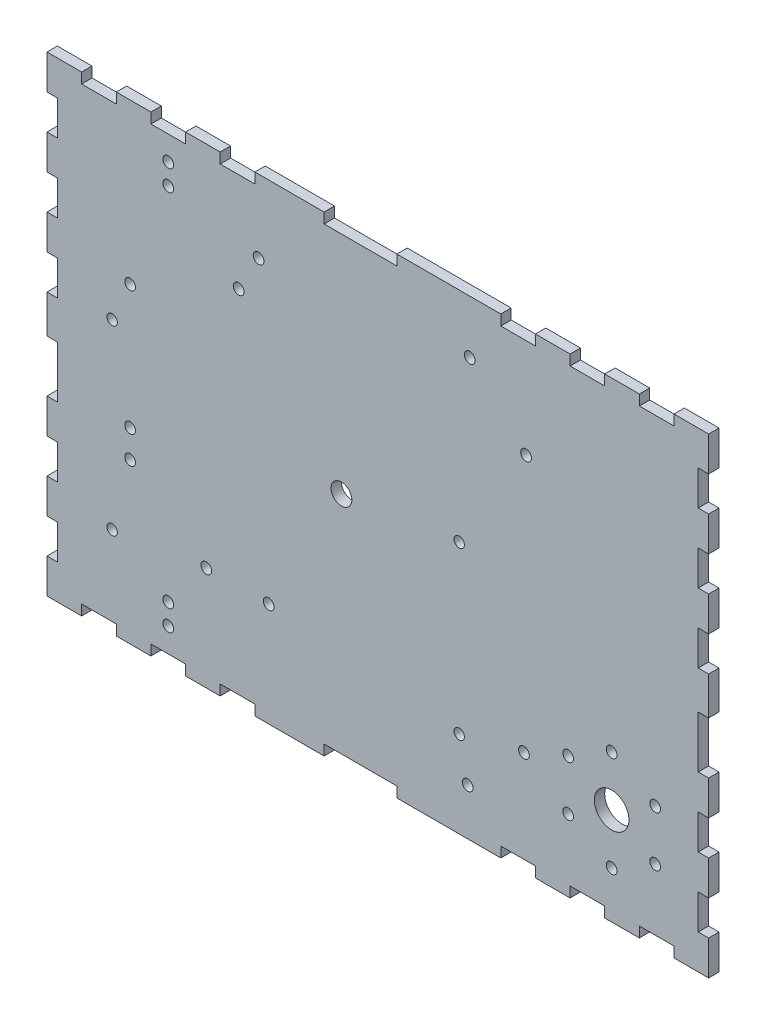
from build123d import *

# Parameters (mm, degrees)
SKETCH2_W           = 191
SKETCH2_H           = 136
SKETCH2_R           = 1.55
SKETCH2_R_2         = 1.549999948
SKETCH2_R_3         = 1.5
BOSS_EXTRUDE1_DEPTH = 3
CUT_EXTRUDE1_REACH  = 236.491
SKETCH3_W           = 10
SKETCH3_H           = 3
SKETCH3_W_2         = 21
CUT_EXTRUDE2_REACH  = 236.491
SKETCH4_W           = 3
SKETCH4_H           = 10
SKETCH4_H_2         = 15
CUT_EXTRUDE3_REACH  = 236.491
SKETCH8_R           = 5
CUT_EXTRUDE4_REACH  = 236.491
SKETCH9_R           = 3
CUT_EXTRUDE5_REACH  = 236.491
SKETCH10_R          = 1.55


with BuildPart() as part:
    # Sketch2 → Boss-Extrude1 (new body)
    with BuildSketch(Plane.XY):
        with Locations((95.5, 68)):
            Rectangle(SKETCH2_W, SKETCH2_H)
        with Locations((35, 16)):
            Circle(SKETCH2_R, mode=Mode.SUBTRACT)
        with Locations((35, 10)):
            Circle(SKETCH2_R, mode=Mode.SUBTRACT)
        with Locations((24, 46.069195574)):
            Circle(SKETCH2_R, mode=Mode.SUBTRACT)
        with Locations((24, 54.069195574)):
            Circle(SKETCH2_R, mode=Mode.SUBTRACT)
        with Locations((24, 89.930804426)):
            Circle(SKETCH2_R, mode=Mode.SUBTRACT)
        with Locations((35, 120)):
            Circle(SKETCH2_R, mode=Mode.SUBTRACT)
        with Locations((35, 126)):
            Circle(SKETCH2_R, mode=Mode.SUBTRACT)
        with Locations((175.557368355, 35.25)):
            Circle(SKETCH2_R_2, mode=Mode.SUBTRACT)
        with Locations((163, 42.5)):
            Circle(SKETCH2_R_2, mode=Mode.SUBTRACT)
        with Locations((150.442631645, 35.25)):
            Circle(SKETCH2_R_2, mode=Mode.SUBTRACT)
        with Locations((150.442631645, 20.75)):
            Circle(SKETCH2_R_2, mode=Mode.SUBTRACT)
        with Locations((163, 13.5)):
            Circle(SKETCH2_R_2, mode=Mode.SUBTRACT)
        with Locations((175.557368355, 20.75)):
            Circle(SKETCH2_R_2, mode=Mode.SUBTRACT)
        with Locations((18.8, 78.5)):
            Circle(SKETCH2_R_3, mode=Mode.SUBTRACT)
        with Locations((18.8, 26)):
            Circle(SKETCH2_R_3, mode=Mode.SUBTRACT)
        with Locations((119, 73)):
            Circle(SKETCH2_R_3, mode=Mode.SUBTRACT)
        with Locations((119, 25)):
            Circle(SKETCH2_R_3, mode=Mode.SUBTRACT)
    extrude(amount=BOSS_EXTRUDE1_DEPTH)

    # Sketch3 → Cut-Extrude1 (cut, up to next)
    with BuildSketch(Plane.XY.offset(3), mode=Mode.PRIVATE) as cut_extrude1_sk1:
        with Locations((176, 1.5)):
            Rectangle(SKETCH3_W, SKETCH3_H)
    cut_extrude1_tool1 = extrude(cut_extrude1_sk1.sketch, amount=-CUT_EXTRUDE1_REACH, mode=Mode.PRIVATE) & part.part
    # Sketch3 → Cut-Extrude1 (cut, up to next)
    with BuildSketch(Plane.XY.offset(3), mode=Mode.PRIVATE) as cut_extrude1_sk2:
        with Locations((156, 1.5)):
            Rectangle(SKETCH3_W, SKETCH3_H)
    cut_extrude1_tool2 = extrude(cut_extrude1_sk2.sketch, amount=-CUT_EXTRUDE1_REACH, mode=Mode.PRIVATE) & part.part
    # Sketch3 → Cut-Extrude1 (cut, up to next)
    with BuildSketch(Plane.XY.offset(3), mode=Mode.PRIVATE) as cut_extrude1_sk3:
        with Locations((136, 1.5)):
            Rectangle(SKETCH3_W, SKETCH3_H)
    cut_extrude1_tool3 = extrude(cut_extrude1_sk3.sketch, amount=-CUT_EXTRUDE1_REACH, mode=Mode.PRIVATE) & part.part
    # Sketch3 → Cut-Extrude1 (cut, up to next)
    with BuildSketch(Plane.XY.offset(3), mode=Mode.PRIVATE) as cut_extrude1_sk4:
        with Locations((90.5, 1.5)):
            Rectangle(SKETCH3_W_2, SKETCH3_H)
    cut_extrude1_tool4 = extrude(cut_extrude1_sk4.sketch, amount=-CUT_EXTRUDE1_REACH, mode=Mode.PRIVATE) & part.part
    # Sketch3 → Cut-Extrude1 (cut, up to next)
    with BuildSketch(Plane.XY.offset(3), mode=Mode.PRIVATE) as cut_extrude1_sk5:
        with Locations((55, 1.5)):
            Rectangle(SKETCH3_W, SKETCH3_H)
    cut_extrude1_tool5 = extrude(cut_extrude1_sk5.sketch, amount=-CUT_EXTRUDE1_REACH, mode=Mode.PRIVATE) & part.part
    # Sketch3 → Cut-Extrude1 (cut, up to next)
    with BuildSketch(Plane.XY.offset(3), mode=Mode.PRIVATE) as cut_extrude1_sk6:
        with Locations((35, 1.5)):
            Rectangle(SKETCH3_W, SKETCH3_H)
    cut_extrude1_tool6 = extrude(cut_extrude1_sk6.sketch, amount=-CUT_EXTRUDE1_REACH, mode=Mode.PRIVATE) & part.part
    # Sketch3 → Cut-Extrude1 (cut, up to next)
    with BuildSketch(Plane.XY.offset(3), mode=Mode.PRIVATE) as cut_extrude1_sk7:
        with Locations((15, 1.5)):
            Rectangle(SKETCH3_W, SKETCH3_H)
    cut_extrude1_tool7 = extrude(cut_extrude1_sk7.sketch, amount=-CUT_EXTRUDE1_REACH, mode=Mode.PRIVATE) & part.part
    cut_extrude1_1 = cut_extrude1_tool1.solids().sort_by_distance((176, 1.5, 3))[0]
    add(cut_extrude1_1, mode=Mode.SUBTRACT)
    cut_extrude1_2 = cut_extrude1_tool2.solids().sort_by_distance((156, 1.5, 3))[0]
    add(cut_extrude1_2, mode=Mode.SUBTRACT)
    cut_extrude1_3 = cut_extrude1_tool3.solids().sort_by_distance((136, 1.5, 3))[0]
    add(cut_extrude1_3, mode=Mode.SUBTRACT)
    cut_extrude1_4 = cut_extrude1_tool4.solids().sort_by_distance((90.5, 1.5, 3))[0]
    add(cut_extrude1_4, mode=Mode.SUBTRACT)
    cut_extrude1_5 = cut_extrude1_tool5.solids().sort_by_distance((55, 1.5, 3))[0]
    add(cut_extrude1_5, mode=Mode.SUBTRACT)
    cut_extrude1_6 = cut_extrude1_tool6.solids().sort_by_distance((35, 1.5, 3))[0]
    add(cut_extrude1_6, mode=Mode.SUBTRACT)
    cut_extrude1_7 = cut_extrude1_tool7.solids().sort_by_distance((15, 1.5, 3))[0]
    add(cut_extrude1_7, mode=Mode.SUBTRACT)
    cut_extrude1 = cut_extrude1_1 + cut_extrude1_2 + cut_extrude1_3 + cut_extrude1_4 + cut_extrude1_5 + cut_extrude1_6 + cut_extrude1_7  # Cut-Extrude1 as one shape, for the pattern or mirror that repeats it

    # Mirror1: Cut-Extrude1 across plane
    add(cut_extrude1.mirror(Plane.ZX.offset(68)), mode=Mode.SUBTRACT)

    # Sketch4 → Cut-Extrude2 (cut, up to next)
    with BuildSketch(Plane.XY.offset(3), mode=Mode.PRIVATE) as cut_extrude2_sk1:
        with Locations((1.5, 121)):
            Rectangle(SKETCH4_W, SKETCH4_H)
    cut_extrude2_tool1 = extrude(cut_extrude2_sk1.sketch, amount=-CUT_EXTRUDE2_REACH, mode=Mode.PRIVATE) & part.part
    # Sketch4 → Cut-Extrude2 (cut, up to next)
    with BuildSketch(Plane.XY.offset(3), mode=Mode.PRIVATE) as cut_extrude2_sk2:
        with Locations((1.5, 101)):
            Rectangle(SKETCH4_W, SKETCH4_H)
    cut_extrude2_tool2 = extrude(cut_extrude2_sk2.sketch, amount=-CUT_EXTRUDE2_REACH, mode=Mode.PRIVATE) & part.part
    # Sketch4 → Cut-Extrude2 (cut, up to next)
    with BuildSketch(Plane.XY.offset(3), mode=Mode.PRIVATE) as cut_extrude2_sk3:
        with Locations((1.5, 81)):
            Rectangle(SKETCH4_W, SKETCH4_H)
    cut_extrude2_tool3 = extrude(cut_extrude2_sk3.sketch, amount=-CUT_EXTRUDE2_REACH, mode=Mode.PRIVATE) & part.part
    # Sketch4 → Cut-Extrude2 (cut, up to next)
    with BuildSketch(Plane.XY.offset(3), mode=Mode.PRIVATE) as cut_extrude2_sk4:
        with Locations((1.5, 15)):
            Rectangle(SKETCH4_W, SKETCH4_H)
    cut_extrude2_tool4 = extrude(cut_extrude2_sk4.sketch, amount=-CUT_EXTRUDE2_REACH, mode=Mode.PRIVATE) & part.part
    # Sketch4 → Cut-Extrude2 (cut, up to next)
    with BuildSketch(Plane.XY.offset(3), mode=Mode.PRIVATE) as cut_extrude2_sk5:
        with Locations((1.5, 35)):
            Rectangle(SKETCH4_W, SKETCH4_H)
    cut_extrude2_tool5 = extrude(cut_extrude2_sk5.sketch, amount=-CUT_EXTRUDE2_REACH, mode=Mode.PRIVATE) & part.part
    # Sketch4 → Cut-Extrude2 (cut, up to next)
    with BuildSketch(Plane.XY.offset(3), mode=Mode.PRIVATE) as cut_extrude2_sk6:
        with Locations((1.5, 57.5)):
            Rectangle(SKETCH4_W, SKETCH4_H_2)
    cut_extrude2_tool6 = extrude(cut_extrude2_sk6.sketch, amount=-CUT_EXTRUDE2_REACH, mode=Mode.PRIVATE) & part.part
    cut_extrude2_1 = cut_extrude2_tool1.solids().sort_by_distance((1.5, 121, 3))[0]
    add(cut_extrude2_1, mode=Mode.SUBTRACT)
    cut_extrude2_2 = cut_extrude2_tool2.solids().sort_by_distance((1.5, 101, 3))[0]
    add(cut_extrude2_2, mode=Mode.SUBTRACT)
    cut_extrude2_3 = cut_extrude2_tool3.solids().sort_by_distance((1.5, 81, 3))[0]
    add(cut_extrude2_3, mode=Mode.SUBTRACT)
    cut_extrude2_4 = cut_extrude2_tool4.solids().sort_by_distance((1.5, 15, 3))[0]
    add(cut_extrude2_4, mode=Mode.SUBTRACT)
    cut_extrude2_5 = cut_extrude2_tool5.solids().sort_by_distance((1.5, 35, 3))[0]
    add(cut_extrude2_5, mode=Mode.SUBTRACT)
    cut_extrude2_6 = cut_extrude2_tool6.solids().sort_by_distance((1.5, 57.5, 3))[0]
    add(cut_extrude2_6, mode=Mode.SUBTRACT)
    cut_extrude2 = cut_extrude2_1 + cut_extrude2_2 + cut_extrude2_3 + cut_extrude2_4 + cut_extrude2_5 + cut_extrude2_6  # Cut-Extrude2 as one shape, for the pattern or mirror that repeats it

    # Mirror2: Cut-Extrude2 across plane
    add(cut_extrude2.mirror(Plane(origin=(95.5, 0, 0), x_dir=(0, 0, 1), z_dir=(1, 0, 0))), mode=Mode.SUBTRACT)

    # Sketch8 → Cut-Extrude3 (cut, up to next)
    with BuildSketch(Plane(origin=(0, 0, 0), x_dir=(-1, 0, 0), z_dir=(0, 0, -1)), mode=Mode.PRIVATE) as cut_extrude3_sk1:
        with Locations((-163, 28)):
            Circle(SKETCH8_R)
    cut_extrude3_tool1 = extrude(cut_extrude3_sk1.sketch, amount=-CUT_EXTRUDE3_REACH, mode=Mode.PRIVATE) & part.part
    add(cut_extrude3_tool1.solids().sort_by_distance((163, 28, 0))[0], mode=Mode.SUBTRACT)

    # Sketch9 → Cut-Extrude4 (cut, up to next)
    with BuildSketch(Plane.XY.offset(3), mode=Mode.PRIVATE) as cut_extrude4_sk1:
        with Locations((85, 68)):
            Circle(SKETCH9_R)
    cut_extrude4_tool1 = extrude(cut_extrude4_sk1.sketch, amount=-CUT_EXTRUDE4_REACH, mode=Mode.PRIVATE) & part.part
    add(cut_extrude4_tool1.solids().sort_by_distance((85, 68, 3))[0], mode=Mode.SUBTRACT)

    # Sketch10 → Cut-Extrude5 (cut, up to next)
    with BuildSketch(Plane.XY.offset(3), mode=Mode.PRIVATE) as cut_extrude5_sk1:
        with Locations((61.086070947, 114.989325612)):
            Circle(SKETCH10_R)
    cut_extrude5_tool1 = extrude(cut_extrude5_sk1.sketch, amount=-CUT_EXTRUDE5_REACH, mode=Mode.PRIVATE) & part.part
    # Sketch10 → Cut-Extrude5 (cut, up to next)
    with BuildSketch(Plane.XY.offset(3), mode=Mode.PRIVATE) as cut_extrude5_sk2:
        with Locations((55.342481492, 104.453141285)):
            Circle(SKETCH10_R)
    cut_extrude5_tool2 = extrude(cut_extrude5_sk2.sketch, amount=-CUT_EXTRUDE5_REACH, mode=Mode.PRIVATE) & part.part
    # Sketch10 → Cut-Extrude5 (cut, up to next)
    with BuildSketch(Plane.XY.offset(3), mode=Mode.PRIVATE) as cut_extrude5_sk3:
        with Locations((138.302074071, 104.36707814)):
            Circle(SKETCH10_R)
    cut_extrude5_tool3 = extrude(cut_extrude5_sk3.sketch, amount=-CUT_EXTRUDE5_REACH, mode=Mode.PRIVATE) & part.part
    # Sketch10 → Cut-Extrude5 (cut, up to next)
    with BuildSketch(Plane.XY.offset(3), mode=Mode.PRIVATE) as cut_extrude5_sk4:
        with Locations((122.038618104, 120.630534107)):
            Circle(SKETCH10_R)
    cut_extrude5_tool4 = extrude(cut_extrude5_sk4.sketch, amount=-CUT_EXTRUDE5_REACH, mode=Mode.PRIVATE) & part.part
    # Sketch10 → Cut-Extrude5 (cut, up to next)
    with BuildSketch(Plane.XY.offset(3), mode=Mode.PRIVATE) as cut_extrude5_sk5:
        with Locations((64, 30)):
            Circle(SKETCH10_R)
    cut_extrude5_tool5 = extrude(cut_extrude5_sk5.sketch, amount=-CUT_EXTRUDE5_REACH, mode=Mode.PRIVATE) & part.part
    # Sketch10 → Cut-Extrude5 (cut, up to next)
    with BuildSketch(Plane.XY.offset(3), mode=Mode.PRIVATE) as cut_extrude5_sk6:
        with Locations((46, 30)):
            Circle(SKETCH10_R)
    cut_extrude5_tool6 = extrude(cut_extrude5_sk6.sketch, amount=-CUT_EXTRUDE5_REACH, mode=Mode.PRIVATE) & part.part
    # Sketch10 → Cut-Extrude5 (cut, up to next)
    with BuildSketch(Plane.XY.offset(3), mode=Mode.PRIVATE) as cut_extrude5_sk7:
        with Locations((137.698811825, 29.728755384)):
            Circle(SKETCH10_R)
    cut_extrude5_tool7 = extrude(cut_extrude5_sk7.sketch, amount=-CUT_EXTRUDE5_REACH, mode=Mode.PRIVATE) & part.part
    # Sketch10 → Cut-Extrude5 (cut, up to next)
    with BuildSketch(Plane.XY.offset(3), mode=Mode.PRIVATE) as cut_extrude5_sk8:
        with Locations((121.435355858, 13.465299417)):
            Circle(SKETCH10_R)
    cut_extrude5_tool8 = extrude(cut_extrude5_sk8.sketch, amount=-CUT_EXTRUDE5_REACH, mode=Mode.PRIVATE) & part.part
    add(cut_extrude5_tool1.solids().sort_by_distance((61.086071, 114.989326, 3))[0], mode=Mode.SUBTRACT)
    add(cut_extrude5_tool2.solids().sort_by_distance((55.342481, 104.453141, 3))[0], mode=Mode.SUBTRACT)
    add(cut_extrude5_tool3.solids().sort_by_distance((138.302074, 104.367078, 3))[0], mode=Mode.SUBTRACT)
    add(cut_extrude5_tool4.solids().sort_by_distance((122.038618, 120.630534, 3))[0], mode=Mode.SUBTRACT)
    add(cut_extrude5_tool5.solids().sort_by_distance((64, 30, 3))[0], mode=Mode.SUBTRACT)
    add(cut_extrude5_tool6.solids().sort_by_distance((46, 30, 3))[0], mode=Mode.SUBTRACT)
    add(cut_extrude5_tool7.solids().sort_by_distance((137.698812, 29.728755, 3))[0], mode=Mode.SUBTRACT)
    add(cut_extrude5_tool8.solids().sort_by_distance((121.435356, 13.465299, 3))[0], mode=Mode.SUBTRACT)


solid = part.part
